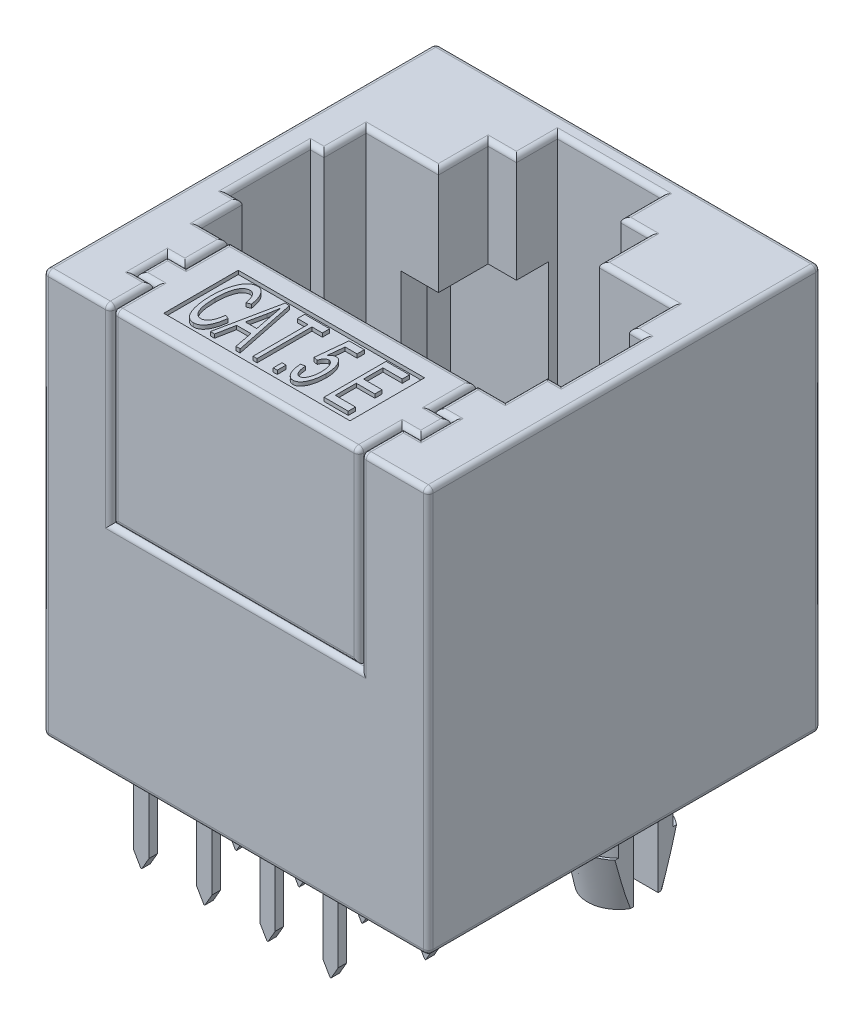
from build123d import *

# Parameters (mm, degrees)
SKETCH1_W            = 15.5
SKETCH1_H            = 15.8
EXTRUDE1_DEPTH       = 16.3
EXTRUDE2_DEPTH       = 13.55
SKETCH3_R            = 1.65
EXTRUDE3_DEPTH       = 3.3
CHAMFER1_SIZE        = 2
CHAMFER1_SIZE2       = 0.4
EXTRUDE4_REACH       = 25.202
SKETCH5_OUTSIDE_W    = 23.412
SKETCH5_OUTSIDE_H    = 23.712
SKETCH5_OUTSIDE_R    = 1.55
EXTRUDE5_DEPTH       = 1.3
EXTRUDE6_DEPTH       = 7.62
EXTRUDE7_REACH       = 25.987
SKETCH7_W            = 10.1
SKETCH7_H            = 0.1
SKETCH8_W            = 7.5
SKETCH8_H            = 3
EXTRUDE8_DEPTH       = 0.15
SKETCH9_W            = 0.162337662
SKETCH9_H            = 0.357142857
CAT_5_E_DEPTH        = 0.15
EXTRUDE10_DEPTH      = 12
SKETCH12_W           = 0.5
SKETCH12_H           = 5.7
EXTRUDE11_DEPTH      = 19.378112055
SKETCH13_W           = 9.5
SKETCH13_H           = 3
SKETCH13_W_2         = 4.912998672
SKETCH13_H_2         = 1.75012399
EXTRUDE12_DEPTH      = 1
EXTRUDE13_START      = 0.05
EXTRUDE13_DEPTH      = 0.4
LPATTERN2_COUNT      = 8
LPATTERN2_PITCH      = 1
EXTRUDE14_START      = 8.89
EXTRUDE14_DEPTH      = 0.17
LPATTERN3_COUNT      = 8
LPATTERN3_PITCH      = 1.27
LPATTERN3_COUNT_DIR2 = 2
LPATTERN3_PITCH_DIR2 = 2.54
FILLET1_R            = 0.2


# Read off the part's stored shape, not the designer's step: Mirror2
with BuildPart() as part:
    # Sketch1 → Extrude1 (new body)
    with BuildSketch(Plane(origin=(0, 0, 0), x_dir=(1, 0, 0), z_dir=(0, 1, 0))):
        with Locations((0, -1.8)):
            Rectangle(SKETCH1_W, SKETCH1_H)
    extrude(amount=EXTRUDE1_DEPTH)

    # Sketch2 → Extrude2 (cut)
    with BuildSketch(Plane(origin=(0, 16.3, 0), x_dir=(1, 0, 0), z_dir=(0, 1, 0))):
        Polygon((2.1, 5.35), (-2.1, 5.35), (-2.1, 3.7), (-3.24, 3.7), (-3.24, 1.7), (-6.15, 1.7), (-6.15, 0), (-6.7, 0), (-6.7, -3.3), (-6.15, -3.3), (-6.15, -5), (6.15, -5), (6.15, -3.3), (6.7, -3.3), (6.7, 0), (6.15, 0), (6.15, 1.7), (3.24, 1.7), (3.24, 3.7), (2.1, 3.7), align=None)
    extrude(amount=-EXTRUDE2_DEPTH, mode=Mode.SUBTRACT)

    # Sketch3 → Extrude3 (add)
    with BuildSketch(Plane.XZ):
        with Locations(Location((5.715, 0, 0), (0, 0, 90))):
            Circle(SKETCH3_R)
    extrude(amount=EXTRUDE3_DEPTH)

    # Chamfer1
    chamfer1_edges = [part.edges().sort_by_distance(p)[0] for p in [
        (5.715, -3.3, -1.65),
    ]]
    chamfer1_side = [part.faces().sort_by_distance(p)[0] for p in [
        (5.715, -1.65, -1.65),
    ]]
    chamfer(chamfer1_edges, length=CHAMFER1_SIZE, length2=CHAMFER1_SIZE2, reference=chamfer1_side[0])

    # Extrude4: up to this face of the body (flat: up to its plane)
    extrude4_end = Plane(part.part.faces().sort_by_distance((-0.206815877, 0, 1.865138859))[0])
    # Sketch4 → Extrude4 (cut, up to the picked face)
    with BuildSketch(Plane.XZ.offset(3.3), mode=Mode.PRIVATE) as extrude4_sk1:
        with BuildLine():
            ThreePointArc((6.965, 0), (6.924338662, -0.316227766), (6.805, -0.611882342))
            Line((6.805, -0.611882342), (6.805, -1.238709005))
            ThreePointArc((6.805, -1.238709005), (7.365, 0), (6.805, 1.238709005))
            Line((6.805, 1.238709005), (6.805, 0.611882342))
            ThreePointArc((6.805, 0.611882342), (6.924338662, 0.316227766), (6.965, 0))
        make_face()
    extrude4_tool1 = split(extrude(extrude4_sk1.sketch, amount=-EXTRUDE4_REACH, mode=Mode.PRIVATE), bisect_by=extrude4_end, keep=Keep.BOTH, mode=Mode.PRIVATE)
    # Sketch4 → Extrude4 (cut, up to the picked face)
    with BuildSketch(Plane.XZ.offset(3.3), mode=Mode.PRIVATE) as extrude4_sk2:
        with BuildLine():
            Line((4.142581481, -0.5), (4.569356076, -0.5))
            ThreePointArc((4.569356076, -0.5), (4.466562367, 0.062477805), (4.625, 0.611882342))
            Line((4.625, 0.611882342), (4.625, 1.238709005))
            ThreePointArc((4.625, 1.238709005), (4.125064358, 0.441140177), (4.142581481, -0.5))
        make_face()
    extrude4_tool2 = split(extrude(extrude4_sk2.sketch, amount=-EXTRUDE4_REACH, mode=Mode.PRIVATE), bisect_by=extrude4_end, keep=Keep.BOTH, mode=Mode.PRIVATE)
    # Sketch4 → Extrude4 (cut, up to the picked face)
    with BuildSketch(Plane.XZ.offset(3.3), mode=Mode.PRIVATE) as extrude4_sk3:
        with BuildLine():
            Line((4.569356076, -0.5), (4.625, -0.5))
            Line((4.625, -0.5), (6.805, -0.5))
            Line((6.805, -0.5), (6.805, -0.611882342))
            ThreePointArc((6.805, -0.611882342), (6.924338662, -0.316227766), (6.965, 0))
            ThreePointArc((6.965, 0), (6.924338662, 0.316227766), (6.805, 0.611882342))
            Line((6.805, 0.611882342), (6.805, 0.5))
            Line((6.805, 0.5), (4.625, 0.5))
            Line((4.625, 0.5), (4.625, 0.611882342))
            ThreePointArc((4.625, 0.611882342), (4.466562367, 0.062477805), (4.569356076, -0.5))
        make_face()
    extrude4_tool3 = split(extrude(extrude4_sk3.sketch, amount=-EXTRUDE4_REACH, mode=Mode.PRIVATE), bisect_by=extrude4_end, keep=Keep.BOTH, mode=Mode.PRIVATE)
    # Sketch4 → Extrude4 (cut, up to the picked face)
    with BuildSketch(Plane.XZ.offset(3.3), mode=Mode.PRIVATE) as extrude4_sk4:
        with BuildLine():
            Line((4.625, -1.238709005), (4.625, -0.611882342))
            ThreePointArc((4.625, -0.611882342), (4.595779131, -0.556636908), (4.569356076, -0.5))
            Line((4.569356076, -0.5), (4.142581481, -0.5))
            ThreePointArc((4.142581481, -0.5), (4.33350051, -0.902196851), (4.625, -1.238709005))
        make_face()
    extrude4_tool4 = split(extrude(extrude4_sk4.sketch, amount=-EXTRUDE4_REACH, mode=Mode.PRIVATE), bisect_by=extrude4_end, keep=Keep.BOTH, mode=Mode.PRIVATE)
    add(extrude4_tool1.solids().sort_by(Axis((7.058658, -3.3, 0), (0, 1, 0)))[0], mode=Mode.SUBTRACT)
    add(extrude4_tool2.solids().sort_by(Axis((4.346284, -3.3, 0.262558), (0, 1, 0)))[0], mode=Mode.SUBTRACT)
    add(extrude4_tool3.solids().sort_by(Axis((5.716473, -3.3, 0.000715), (0, 1, 0)))[0], mode=Mode.SUBTRACT)
    add(extrude4_tool4.solids().sort_by(Axis((4.445061, -3.3, -0.772412), (0, 1, 0)))[0], mode=Mode.SUBTRACT)

    # Sketch5 outside → Extrude5 (cut)
    with BuildSketch(Plane.XZ):
        with Locations((0, 1.8)):
            Rectangle(SKETCH5_OUTSIDE_W, SKETCH5_OUTSIDE_H)
        with Locations((5.715, 0)):
            Circle(SKETCH5_OUTSIDE_R, mode=Mode.SUBTRACT)
    extrude(amount=EXTRUDE5_DEPTH, mode=Mode.SUBTRACT)

    # Mirror2: part across plane


with BuildPart() as part_1:
    add(part.part)
    add(part.part.mirror(Plane(origin=(0, 0, 0), x_dir=(0, 0, 1), z_dir=(1, 0, 0))))

    # Sketch6 → Extrude6 (cut)
    with BuildSketch(Plane(origin=(0, 16.3, 0), x_dir=(1, 0, 0), z_dir=(0, 1, 0))):
        Polygon((-5.05, -5), (-5.05, -6.7), (-5.75, -6.7), (-5.75, -8), (-5.05, -8), (-5.05, -9.7), (-4.95, -9.7), (-4.95, -7.95), (-5.7, -7.95), (-5.7, -6.75), (-4.95, -6.75), (-4.95, -5), align=None)
        Polygon((4.95, -5), (5.05, -5), (5.05, -6.7), (5.75, -6.7), (5.75, -8), (5.05, -8), (5.05, -9.7), (4.95, -9.7), (4.95, -7.95), (5.7, -7.95), (5.7, -6.75), (4.95, -6.75), align=None)
    extrude(amount=-EXTRUDE6_DEPTH, mode=Mode.SUBTRACT)

    # Sketch7 → Extrude7 (cut, up to next)
    with BuildSketch(Plane.XY.offset(9.7), mode=Mode.PRIVATE) as extrude7_sk1:
        with Locations((0, 8.73)):
            Rectangle(SKETCH7_W, SKETCH7_H)
    extrude7_tool1 = extrude(extrude7_sk1.sketch, amount=-EXTRUDE7_REACH, mode=Mode.PRIVATE) & part_1.part
    add(extrude7_tool1.solids().sort_by_distance((0, 8.73, 9.7))[0], mode=Mode.SUBTRACT)

    # Sketch8 → Extrude8 (cut)
    with BuildSketch(Plane(origin=(0, 16.3, 0), x_dir=(1, 0, 0), z_dir=(0, 1, 0))):
        with Locations((0, -7.35)):
            Rectangle(SKETCH8_W, SKETCH8_H)
    extrude(amount=-EXTRUDE8_DEPTH, mode=Mode.SUBTRACT)

    # Sketch9 → CAT.5 E (add)
    # profile 1 of 6: a face of its own
    with BuildSketch(Plane(origin=(0, 16.15, 0), x_dir=(1, 0, 0), z_dir=(0, 1, 0))):
        with BuildLine():
            Line((-2.435064935, -7.673376623), (-2.272727273, -7.738311688))
            add(Edge.make_bspline(
                [(-2.272727273, -7.738311688), (-2.277770751, -7.772670518), (-2.287559142, -7.839354196), (-2.305048858, -7.935761824), (-2.32572718, -8.025370989), (-2.349780188, -8.108004982), (-2.375250122, -8.184485721), (-2.404109606, -8.253977969), (-2.435578764, -8.316757415), (-2.469510709, -8.372879484), (-2.505920279, -8.422095983), (-2.544319646, -8.464746195), (-2.584387237, -8.501127567), (-2.626781035, -8.530861622), (-2.671271616, -8.55408197), (-2.71781937, -8.570098868), (-2.765995928, -8.581068197), (-2.798910439, -8.581997771), (-2.815543831, -8.582467532)],
                knots=[0, 0, 0, 0, 1.527427999, 2.964434904, 4.308582902, 5.570379206, 6.74881102, 7.852502984, 8.87703834, 9.835046151, 10.733573371, 11.565637926, 12.355683227, 13.108838334, 13.837387397, 14.554879517, 15.269706452, 16, 16, 16, 16], degree=3))
            add(Edge.make_bspline(
                [(-2.815543831, -8.582467532), (-2.830114577, -8.582128964), (-2.859071089, -8.581456125), (-2.901533789, -8.574520238), (-2.942503363, -8.564147538), (-2.981401223, -8.548399997), (-3.01917845, -8.529265488), (-3.055124717, -8.505269229), (-3.089469598, -8.477077373), (-3.121945129, -8.444341449), (-3.153306853, -8.407039178), (-3.18222196, -8.364114719), (-3.211165474, -8.316960863), (-3.237012464, -8.263778304), (-3.262672984, -8.205902802), (-3.286132601, -8.1425892), (-3.308621145, -8.07426877), (-3.329202351, -8.001134065), (-3.347872076, -7.923442596), (-3.364733246, -7.842133704), (-3.378246006, -7.757286565), (-3.389266936, -7.669112457), (-3.398689552, -7.577638701), (-3.404277938, -7.482510317), (-3.408835249, -7.384087365), (-3.40900471, -7.317254293), (-3.409090909, -7.283258929)],
                knots=[0, 0, 0, 0, 0.670287783, 1.332066086, 1.976017933, 2.612156553, 3.259815912, 3.922738171, 4.597622267, 5.30229679, 6.04295508, 6.837699446, 7.682897312, 8.588175266, 9.557352942, 10.597076729, 11.695153801, 12.868331814, 14.093869647, 15.373415609, 16.690498894, 18.048259579, 19.46440929, 20.923316151, 22.435011488, 24, 24, 24, 24], degree=3))
            add(Edge.make_bspline(
                [(-3.409090909, -7.283258929), (-3.409002142, -7.249771157), (-3.408828123, -7.184121822), (-3.404345171, -7.087720931), (-3.398532404, -6.995163952), (-3.389929849, -6.906501429), (-3.378838848, -6.821719047), (-3.365201855, -6.740984238), (-3.348973316, -6.664139843), (-3.330283435, -6.591379549), (-3.309525027, -6.522633112), (-3.286570685, -6.458244609), (-3.262543643, -6.397754793), (-3.236071547, -6.341955951), (-3.208241589, -6.290563894), (-3.178722684, -6.24352304), (-3.147263087, -6.200712106), (-3.113852473, -6.162363358), (-3.079348772, -6.127945221), (-3.043276797, -6.098709823), (-3.006537734, -6.073285358), (-2.968465238, -6.053166729), (-2.929621352, -6.037059096), (-2.889719495, -6.026124307), (-2.848985899, -6.018399809), (-2.821329704, -6.01782262), (-2.807426948, -6.017532468)],
                knots=[0, 0, 0, 0, 1.573876416, 3.085422919, 4.535184642, 5.932713821, 7.271576118, 8.553474085, 9.780347448, 10.962105425, 12.083543463, 13.154494087, 14.174409489, 15.141512691, 16.055620759, 16.920068892, 17.749913032, 18.549988351, 19.308765019, 20.037470677, 20.729717666, 21.405337217, 22.057741129, 22.701910179, 23.347450846, 24, 24, 24, 24], degree=3))
            add(Edge.make_bspline(
                [(-2.807426948, -6.017532468), (-2.79234546, -6.018178255), (-2.762276598, -6.0194658), (-2.71784719, -6.027973199), (-2.675673077, -6.043719316), (-2.634664475, -6.064155743), (-2.595852007, -6.091277124), (-2.558458349, -6.124142556), (-2.522915668, -6.163037088), (-2.489061539, -6.207750669), (-2.457066725, -6.25808647), (-2.427697786, -6.314135862), (-2.40099339, -6.375589619), (-2.376512585, -6.442471999), (-2.354848161, -6.515020317), (-2.335947568, -6.593176936), (-2.318170703, -6.67662424), (-2.309608656, -6.734466994), (-2.305194805, -6.764285714)],
                knots=[0, 0, 0, 0, 0.74099604, 1.477367961, 2.210499764, 2.946074721, 3.722585034, 4.52904328, 5.387355885, 6.306127767, 7.280911286, 8.313915584, 9.411249806, 10.570209712, 11.810645145, 13.128284404, 14.519591893, 16, 16, 16, 16], degree=3))
            Line((-2.305194805, -6.764285714), (-2.467532468, -6.829220779))
            add(Edge.make_bspline(
                [(-2.467532468, -6.829220779), (-2.471310359, -6.808231684), (-2.478642922, -6.767493656), (-2.491151305, -6.708524093), (-2.505539471, -6.653788591), (-2.520350498, -6.602759333), (-2.537802966, -6.556187665), (-2.556019108, -6.513500265), (-2.575048823, -6.474505329), (-2.596491733, -6.440114321), (-2.618791505, -6.409522087), (-2.642149532, -6.382558707), (-2.667627498, -6.360372526), (-2.694186323, -6.341691836), (-2.722242846, -6.327466476), (-2.751550411, -6.317144702), (-2.782301381, -6.310858169), (-2.803339047, -6.31011675), (-2.814021916, -6.30974026)],
                knots=[0, 0, 0, 0, 1.511222642, 2.933153124, 4.270091548, 5.521142115, 6.696443238, 7.791551002, 8.809744252, 9.767476408, 10.659055049, 11.490981885, 12.28908202, 13.046946601, 13.786495852, 14.510345799, 15.24355775, 16, 16, 16, 16], degree=3))
            add(Edge.make_bspline(
                [(-2.814021916, -6.30974026), (-2.834982438, -6.310993342), (-2.876468048, -6.313473475), (-2.936144281, -6.333954565), (-2.991607659, -6.366460878), (-3.032294389, -6.404560825), (-3.063143935, -6.440271913), (-3.084517407, -6.471982905), (-3.105607281, -6.506467196), (-3.124816154, -6.544927638), (-3.142975187, -6.586975443), (-3.160036447, -6.63258145), (-3.176543911, -6.681528024), (-3.191061683, -6.734239547), (-3.204128335, -6.790448285), (-3.215994441, -6.850119187), (-3.225495193, -6.913442341), (-3.23294933, -6.980477602), (-3.23899115, -7.051017698), (-3.243678107, -7.125263755), (-3.246044735, -7.203089245), (-3.246514121, -7.256201377), (-3.246753247, -7.283258929)],
                knots=[0, 0, 0, 0, 1.075766508, 2.129185019, 3.209162529, 4.360571753, 4.977551641, 5.633804613, 6.32443111, 7.055704351, 7.842587115, 8.679369182, 9.559506974, 10.49856859, 11.490136014, 12.527234371, 13.62692518, 14.782400683, 15.995867473, 17.268131168, 18.608271245, 20, 20, 20, 20], degree=3))
            add(Edge.make_bspline(
                [(-3.246753247, -7.283258929), (-3.246288821, -7.323847336), (-3.245388628, -7.40251965), (-3.240609022, -7.51676672), (-3.231497277, -7.623216249), (-3.218948433, -7.721745414), (-3.203052196, -7.812464402), (-3.182641373, -7.895039739), (-3.159696735, -7.970223162), (-3.132404212, -8.037252476), (-3.101741199, -8.096227769), (-3.069714675, -8.148209395), (-3.033853368, -8.191505938), (-2.996384325, -8.227602224), (-2.956072883, -8.255763525), (-2.913187307, -8.275701596), (-2.867614136, -8.287903561), (-2.836417342, -8.289467594), (-2.820616883, -8.29025974)],
                knots=[0, 0, 0, 0, 1.633649515, 3.166494948, 4.60098046, 5.932248465, 7.163124542, 8.3054058, 9.353717533, 10.324367872, 11.21321266, 12.026997874, 12.776422931, 13.469692788, 14.11535979, 14.745671014, 15.364711208, 16, 16, 16, 16], degree=3))
            add(Edge.make_bspline(
                [(-2.820616883, -8.29025974), (-2.808911156, -8.289746665), (-2.785623876, -8.288725958), (-2.751342057, -8.281269513), (-2.718090793, -8.269715359), (-2.686294756, -8.2527263), (-2.656467501, -8.230435696), (-2.627135892, -8.204398888), (-2.599228434, -8.173274397), (-2.573045354, -8.137061445), (-2.547979349, -8.096340052), (-2.525308591, -8.05041656), (-2.504422286, -7.99963043), (-2.48650155, -7.943700841), (-2.470185974, -7.883105344), (-2.456164967, -7.817553379), (-2.443830347, -7.747188869), (-2.438040974, -7.698437414), (-2.435064935, -7.673376623)],
                knots=[0, 0, 0, 0, 0.709455398, 1.411384984, 2.118464636, 2.838732947, 3.587423504, 4.371785753, 5.214076285, 6.116580963, 7.078646729, 8.110543531, 9.218898219, 10.405831534, 11.669537828, 13.023246291, 14.469793296, 16, 16, 16, 16], degree=3))
        make_face()
    # profile 2 of 6: a face of its own
    with BuildSketch(Plane(origin=(0, 16.15, 0), x_dir=(1, 0, 0), z_dir=(0, 1, 0))):
        Polygon((-2.175324675, -8.55), (-1.661424513, -6.05), (-1.487926136, -6.05), (-0.974025974, -8.55), (-1.143973214, -8.55), (-1.287540584, -7.803246753), (-1.861810065, -7.803246753), (-2.005377435, -8.55), align=None)
        with BuildLine():
            Line((-1.805499188, -7.511038961), (-1.343851461, -7.511038961))
            Line((-1.343851461, -7.511038961), (-1.481331169, -6.824147727))
            add(Edge.make_bspline(
                [(-1.481331169, -6.824147727), (-1.486429869, -6.798449272), (-1.496388562, -6.7482555), (-1.510507485, -6.674848338), (-1.523845444, -6.605036487), (-1.535907827, -6.538895782), (-1.547077201, -6.476498448), (-1.557344104, -6.417839668), (-1.566403488, -6.362867669), (-1.57198997, -6.327330061), (-1.574675325, -6.310247565)],
                knots=[0, 0, 0, 0, 1.203765704, 2.351174126, 3.434612293, 4.469373741, 5.440204073, 6.347122889, 7.205482054, 8, 8, 8, 8], degree=3))
            add(Edge.make_bspline(
                [(-1.574675325, -6.310247565), (-1.58457237, -6.389535951), (-1.604377567, -6.548201693), (-1.635300812, -6.705080117), (-1.650771104, -6.783563312)],
                knots=[0, 0, 0, 0, 0.999439272, 2, 2, 2, 2], degree=3))
            Line((-1.650771104, -6.783563312), (-1.805499188, -7.511038961))
        make_face(mode=Mode.SUBTRACT)
    # profile 3 of 6: a face of its own
    with BuildSketch(Plane(origin=(0, 16.15, 0), x_dir=(1, 0, 0), z_dir=(0, 1, 0))):
        Polygon((-0.454545455, -8.55), (-0.454545455, -6.342207792), (-0.876623377, -6.342207792), (-0.876623377, -6.05), (0.12987013, -6.05), (0.12987013, -6.342207792), (-0.292207792, -6.342207792), (-0.292207792, -8.55), align=None)
    # profile 4 of 6: a face of its own
    with BuildSketch(Plane(origin=(0, 16.15, 0), x_dir=(1, 0, 0), z_dir=(0, 1, 0))):
        with Locations((0.438311688, -8.371428572)):
            Rectangle(SKETCH9_W, SKETCH9_H)
    # profile 5 of 6: a face of its own
    with BuildSketch(Plane(origin=(0, 16.15, 0), x_dir=(1, 0, 0), z_dir=(0, 1, 0))):
        with BuildLine():
            Line((0.779220779, -7.868181818), (0.941558442, -7.835714286))
            add(Edge.make_bspline(
                [(0.941558442, -7.835714286), (0.943283263, -7.855513041), (0.946635615, -7.89399378), (0.953733166, -7.949668167), (0.9622547, -8.001475426), (0.972417503, -8.049380757), (0.983927034, -8.093458072), (0.997068791, -8.133638865), (1.011644662, -8.169842926), (1.028064121, -8.201915927), (1.045088509, -8.230427052), (1.063322106, -8.254885868), (1.08243115, -8.275376263), (1.101439399, -8.292825436), (1.121496289, -8.306473516), (1.142562965, -8.315521821), (1.164277947, -8.321505974), (1.179107389, -8.32231781), (1.186586851, -8.322727273)],
                knots=[0, 0, 0, 0, 1.622775067, 3.154015592, 4.581959902, 5.909059291, 7.151713724, 8.300185627, 9.359253996, 10.335012332, 11.239684737, 12.068223321, 12.820654158, 13.524776558, 14.1720332, 14.790360861, 15.389899482, 16, 16, 16, 16], degree=3))
            add(Edge.make_bspline(
                [(1.186586851, -8.322727273), (1.195767727, -8.322227851), (1.214273507, -8.321221172), (1.24133326, -8.313323956), (1.267392827, -8.300198689), (1.29204866, -8.281803672), (1.315621801, -8.25835732), (1.338639036, -8.230294055), (1.360057396, -8.196677209), (1.380842643, -8.158602546), (1.400276405, -8.116253853), (1.415978157, -8.069302289), (1.430571088, -8.019171471), (1.441255188, -7.964950649), (1.450743396, -7.907315728), (1.456262278, -7.845767685), (1.460815784, -7.780654792), (1.460963125, -7.735953704), (1.461038961, -7.712946429)],
                knots=[0, 0, 0, 0, 0.60776083, 1.225056147, 1.851540466, 2.532952689, 3.25412295, 4.050522275, 4.933309596, 5.891220304, 6.924444712, 8.016067347, 9.169070847, 10.382317215, 11.675730468, 13.03841667, 14.475697863, 16, 16, 16, 16], degree=3))
            add(Edge.make_bspline(
                [(1.461038961, -7.712946429), (1.46088919, -7.691465962), (1.46059768, -7.64965701), (1.457046258, -7.588705855), (1.450901708, -7.531519987), (1.443036423, -7.47793889), (1.432228192, -7.428204178), (1.41985896, -7.3819708), (1.404615716, -7.339523), (1.386786884, -7.301190503), (1.367949147, -7.266590147), (1.346788859, -7.236958697), (1.325114158, -7.211441015), (1.302320503, -7.190045339), (1.277463699, -7.174389766), (1.252089548, -7.162218526), (1.224963997, -7.15556233), (1.206573123, -7.154457019), (1.19724026, -7.153896104)],
                knots=[0, 0, 0, 0, 1.527613954, 2.973303183, 4.339991952, 5.617400593, 6.82280013, 7.957804138, 9.019247687, 10.025567651, 10.96243658, 11.816689822, 12.609831467, 13.341996118, 14.029219049, 14.691139328, 15.335789144, 16, 16, 16, 16], degree=3))
            add(Edge.make_bspline(
                [(1.19724026, -7.153896104), (1.185981879, -7.15471775), (1.162989916, -7.156395724), (1.129301676, -7.16927659), (1.09765951, -7.190960748), (1.067240405, -7.219563566), (1.038932062, -7.255274808), (1.013513707, -7.29771156), (0.991936203, -7.346835833), (0.980162196, -7.382078908), (0.974025974, -7.400446429)],
                knots=[0, 0, 0, 0, 0.761550716, 1.555245541, 2.406685125, 3.346816908, 4.373668451, 5.483602989, 6.688537393, 8, 8, 8, 8], degree=3))
            Line((0.974025974, -7.400446429), (0.811688312, -7.363413149))
            Line((0.811688312, -7.363413149), (0.941558442, -6.082467532))
            Line((0.941558442, -6.082467532), (1.558441558, -6.082467532))
            Line((1.558441558, -6.082467532), (1.558441558, -6.374675325))
            Line((1.558441558, -6.374675325), (1.075487013, -6.374675325))
            Line((1.075487013, -6.374675325), (1.010551948, -7.018952922))
            add(Edge.make_bspline(
                [(1.010551948, -7.018952922), (1.019517303, -7.008985544), (1.036891841, -6.989669119), (1.064910772, -6.964164171), (1.093559072, -6.942793576), (1.122162383, -6.924714323), (1.151757647, -6.911680683), (1.181050059, -6.900973621), (1.21141238, -6.895501456), (1.23171964, -6.894604671), (1.241883117, -6.894155844)],
                knots=[0, 0, 0, 0, 1.18584508, 2.298125457, 3.345606505, 4.34651903, 5.284011882, 6.202075847, 7.100166111, 8, 8, 8, 8], degree=3))
            add(Edge.make_bspline(
                [(1.241883117, -6.894155844), (1.254638417, -6.894855682), (1.280047452, -6.896249784), (1.317249775, -6.907094114), (1.353240665, -6.923895252), (1.387570525, -6.948458208), (1.420329846, -6.979614069), (1.452078878, -7.017233707), (1.482500866, -7.061570933), (1.510881564, -7.11270645), (1.537962099, -7.16899939), (1.560437588, -7.231022353), (1.580487559, -7.297300099), (1.595682871, -7.368661273), (1.608805609, -7.444408897), (1.616767678, -7.525116261), (1.622871347, -7.610377329), (1.623205404, -7.668798438), (1.623376623, -7.698741883)],
                knots=[0, 0, 0, 0, 0.632556956, 1.260077104, 1.90995554, 2.597225785, 3.345790324, 4.150076616, 5.037563852, 6.011467768, 7.051990553, 8.136093834, 9.283894979, 10.488035265, 11.756767215, 13.099595046, 14.51341205, 16, 16, 16, 16], degree=3))
            add(Edge.make_bspline(
                [(1.623376623, -7.698741883), (1.622960853, -7.728512433), (1.62214275, -7.787091323), (1.616476782, -7.873254293), (1.607368056, -7.95619908), (1.594880885, -8.036020284), (1.578106855, -8.11254419), (1.557747844, -8.185863919), (1.534126407, -8.255994024), (1.506443156, -8.321924087), (1.476008986, -8.382263941), (1.443224002, -8.435754572), (1.407099492, -8.480797227), (1.368390492, -8.517699865), (1.32727287, -8.547034304), (1.283203142, -8.567331584), (1.236526674, -8.580293595), (1.204428074, -8.581734804), (1.188108766, -8.582467532)],
                knots=[0, 0, 0, 0, 1.329747663, 2.616516755, 3.855210829, 5.056040539, 6.223528764, 7.352407089, 8.453577556, 9.526750137, 10.543550083, 11.469916472, 12.323989094, 13.114758231, 13.852369521, 14.568791923, 15.272356889, 16, 16, 16, 16], degree=3))
            add(Edge.make_bspline(
                [(1.188108766, -8.582467532), (1.174539161, -8.581844791), (1.147631744, -8.580609946), (1.108168764, -8.571860468), (1.070495984, -8.556684728), (1.034294045, -8.535876171), (1.00024688, -8.508408665), (0.967472301, -8.475677074), (0.936755308, -8.436796424), (0.907213834, -8.39271725), (0.880602063, -8.34302587), (0.856766706, -8.288552586), (0.836021925, -8.229516823), (0.818385152, -8.165941077), (0.80360452, -8.098048371), (0.792813058, -8.025469912), (0.783931562, -7.948500996), (0.780818859, -7.895429198), (0.779220779, -7.868181818)],
                knots=[0, 0, 0, 0, 0.723637986, 1.434914875, 2.143441086, 2.882982659, 3.653558286, 4.469968276, 5.349004066, 6.292158939, 7.297125743, 8.351286616, 9.46105729, 10.631939726, 11.868620501, 13.164761758, 14.544371648, 16, 16, 16, 16], degree=3))
        make_face()
    # profile 6 of 6: a face of its own
    with BuildSketch(Plane(origin=(0, 16.15, 0), x_dir=(1, 0, 0), z_dir=(0, 1, 0))):
        Polygon((2.402597403, -8.55), (2.402597403, -6.05), (3.344155844, -6.05), (3.344155844, -6.342207792), (2.564935065, -6.342207792), (2.564935065, -7.121428571), (3.311688312, -7.121428571), (3.311688312, -7.413636364), (2.564935065, -7.413636364), (2.564935065, -8.257792208), (3.376623377, -8.257792208), (3.376623377, -8.55), align=None)
    extrude(amount=CAT_5_E_DEPTH)

    # Sketch10 → Extrude10 (cut)
    with BuildSketch(Plane.XZ):
        Polygon((6.05, -5), (-6.05, -5), (-6.05, -2.75), (-4.75, -2.75), (-4.75, -1.7), (4.75, -1.7), (4.75, -2.75), (6.05, -2.75), align=None)
    extrude(amount=-EXTRUDE10_DEPTH, mode=Mode.SUBTRACT)

    # Sketch12 → Extrude11 (cut, through all)
    with BuildSketch(Plane(origin=(0, 2.75, 0), x_dir=(1, 0, 0), z_dir=(0, 1, 0))):
        with Locations((-3.5, -1.65)):
            Rectangle(SKETCH12_W, SKETCH12_H)
        with Locations((-2.5, -1.65)):
            Rectangle(SKETCH12_W, SKETCH12_H)
        with Locations((-1.5, -1.65)):
            Rectangle(SKETCH12_W, SKETCH12_H)
        with Locations((-0.5, -1.65)):
            Rectangle(SKETCH12_W, SKETCH12_H)
        with Locations((0.5, -1.65)):
            Rectangle(SKETCH12_W, SKETCH12_H)
        with Locations((1.5, -1.65)):
            Rectangle(SKETCH12_W, SKETCH12_H)
        with Locations((2.5, -1.65)):
            Rectangle(SKETCH12_W, SKETCH12_H)
        with Locations((3.5, -1.65)):
            Rectangle(SKETCH12_W, SKETCH12_H)
    extrude(amount=-EXTRUDE11_DEPTH, mode=Mode.SUBTRACT)

    # Sketch13 → Extrude12 (add)
    with BuildSketch(Plane.XZ):
        with Locations((0, -0.2)):
            Rectangle(SKETCH13_W, SKETCH13_H)
        with Locations((0.495517033, 4.125061995)):
            Rectangle(SKETCH13_W_2, SKETCH13_H_2)
    extrude(amount=-EXTRUDE12_DEPTH)

    # Sketch16 → Extrude14 (add, symmetric)
    with BuildSketch(Plane.XY.offset(EXTRUDE14_START)):
        Polygon((-4.755, 0), (-4.135, 0), (-4.135, -2.8), (-4.423675135, -3.3), (-4.466324865, -3.3), (-4.755, -2.8), align=None)
    extrude14 = extrude(amount=EXTRUDE14_DEPTH, both=True)

    # LPattern3: Extrude14 8 × 2, 8 skipped
    with Locations(*[(i * LPATTERN3_PITCH, 0, -j * LPATTERN3_PITCH_DIR2) for i in range(LPATTERN3_COUNT) for j in range(LPATTERN3_COUNT_DIR2) if (i, j) not in ((0, 0), (0, 1), (1, 0), (2, 1), (3, 0), (4, 1), (5, 0), (6, 1), (7, 0))]):
        add(extrude14)

    # Fillet1
    fillet1_edges = [part_1.edges().sort_by_distance(p)[0] for p in [
        (7.75, 16.3, 1.8),
        (0, 16.3, -6.1),
        (0, 16.3, 5),
        (0, 16.3, 9.7),
        (0, 8.68, 9.7),
        (-5.05, 12.49, 9.7),
        (-5.05, 16.3, 5.85),
        (-5.4, 16.3, 6.7),
        (-5.75, 16.3, 7.35),
        (-5.4, 16.3, 8),
        (-5.05, 16.3, 8.85),
        (-4.95, 16.3, 8.825),
        (-5.325, 16.3, 7.95),
        (-5.7, 16.3, 7.35),
        (-5.325, 16.3, 6.75),
        (-4.95, 16.3, 5.875),
        (5.6, 16.3, 5),
        (6.4, 16.3, 9.7),
        (5.05, 12.49, 9.7),
        (4.95, 16.3, 5.875),
        (5.325, 16.3, 6.75),
        (5.7, 16.3, 7.35),
        (5.325, 16.3, 7.95),
        (4.95, 16.3, 8.825),
        (5.05, 16.3, 8.85),
        (5.4, 16.3, 8),
        (5.75, 16.3, 7.35),
        (5.4, 16.3, 6.7),
        (5.05, 16.3, 5.85),
        (4.95, 12.54, 9.7),
        (-4.95, 12.54, 9.7),
        (0, 8.78, 9.7),
        (-2.1, 16.3, -4.525),
        (-2.67, 16.3, -3.7),
        (-3.24, 16.3, -2.7),
        (-4.695, 16.3, -1.7),
        (-6.15, 16.3, -0.85),
        (-6.425, 16.3, 0),
        (-6.7, 16.3, 1.65),
        (-6.425, 16.3, 3.3),
        (-6.15, 16.3, 4.15),
        (-5.6, 16.3, 5),
        (6.15, 16.3, 4.15),
        (6.425, 16.3, 3.3),
        (6.7, 16.3, 1.65),
        (6.425, 16.3, 0),
        (6.15, 16.3, -0.85),
        (4.695, 16.3, -1.7),
        (3.24, 16.3, -2.7),
        (2.67, 16.3, -3.7),
        (2.1, 16.3, -4.525),
        (0, 16.3, -5.35),
        (-7.75, 16.3, 1.8),
        (0, 0, -6.1),
        (7.75, 0, 1.8),
        (0, 0, 9.7),
        (-7.75, 0, 1.8),
        (-6.4, 16.3, 9.7),
        (-7.75, 8.15, -6.1),
        (7.75, 8.15, -6.1),
        (7.75, 8.15, 9.7),
        (-7.75, 8.15, 9.7),
    ]]
    fillet(fillet1_edges, radius=FILLET1_R)


with BuildPart() as body_2:
    # Sketch14 → Extrude13 (new body)
    with BuildSketch(Plane(origin=(-3.75, 0, 0), x_dir=(0, 0, -1), z_dir=(1, 0, 0)).offset(EXTRUDE13_START)):
        with BuildLine():
            Line((-6.7, 8.77), (-5, 8.77))
            ThreePointArc((-5, 8.77), (-4.935525888, 8.751208146), (-4.891244911, 8.700718148))
            Line((-4.891244911, 8.700718148), (-1.3, 1))
            Line((-1.3, 1), (-1.372503393, 0.966187901))
            Line((-1.372503393, 0.966187901), (-4.963748304, 8.666906049))
            ThreePointArc((-4.963748304, 8.666906049), (-4.978508629, 8.683736049), (-5, 8.69))
            Line((-5, 8.69), (-6.7, 8.69))
            Line((-6.7, 8.69), (-6.7, 8.77))
        make_face()
    extrude(amount=EXTRUDE13_DEPTH)


with BuildPart() as lpattern2_1:
    # LPattern2: pattern copy
    add(body_2.part.moved(Location(Vector(1, 0, 0) * (1 * LPATTERN2_PITCH))))


with BuildPart() as lpattern2_2:
    # LPattern2: pattern copy
    add(body_2.part.moved(Location(Vector(1, 0, 0) * (2 * LPATTERN2_PITCH))))


with BuildPart() as lpattern2_3:
    # LPattern2: pattern copy
    add(body_2.part.moved(Location(Vector(1, 0, 0) * (3 * LPATTERN2_PITCH))))


with BuildPart() as lpattern2_4:
    # LPattern2: pattern copy
    add(body_2.part.moved(Location(Vector(1, 0, 0) * (4 * LPATTERN2_PITCH))))


with BuildPart() as lpattern2_5:
    # LPattern2: pattern copy
    add(body_2.part.moved(Location(Vector(1, 0, 0) * (5 * LPATTERN2_PITCH))))


with BuildPart() as lpattern2_6:
    # LPattern2: pattern copy
    add(body_2.part.moved(Location(Vector(1, 0, 0) * (6 * LPATTERN2_PITCH))))


with BuildPart() as lpattern2_7:
    # LPattern2: pattern copy
    add(body_2.part.moved(Location(Vector(1, 0, 0) * (7 * LPATTERN2_PITCH))))


solid = Compound([part_1.part, body_2.part, lpattern2_1.part, lpattern2_2.part, lpattern2_3.part, lpattern2_4.part, lpattern2_5.part, lpattern2_6.part, lpattern2_7.part])
